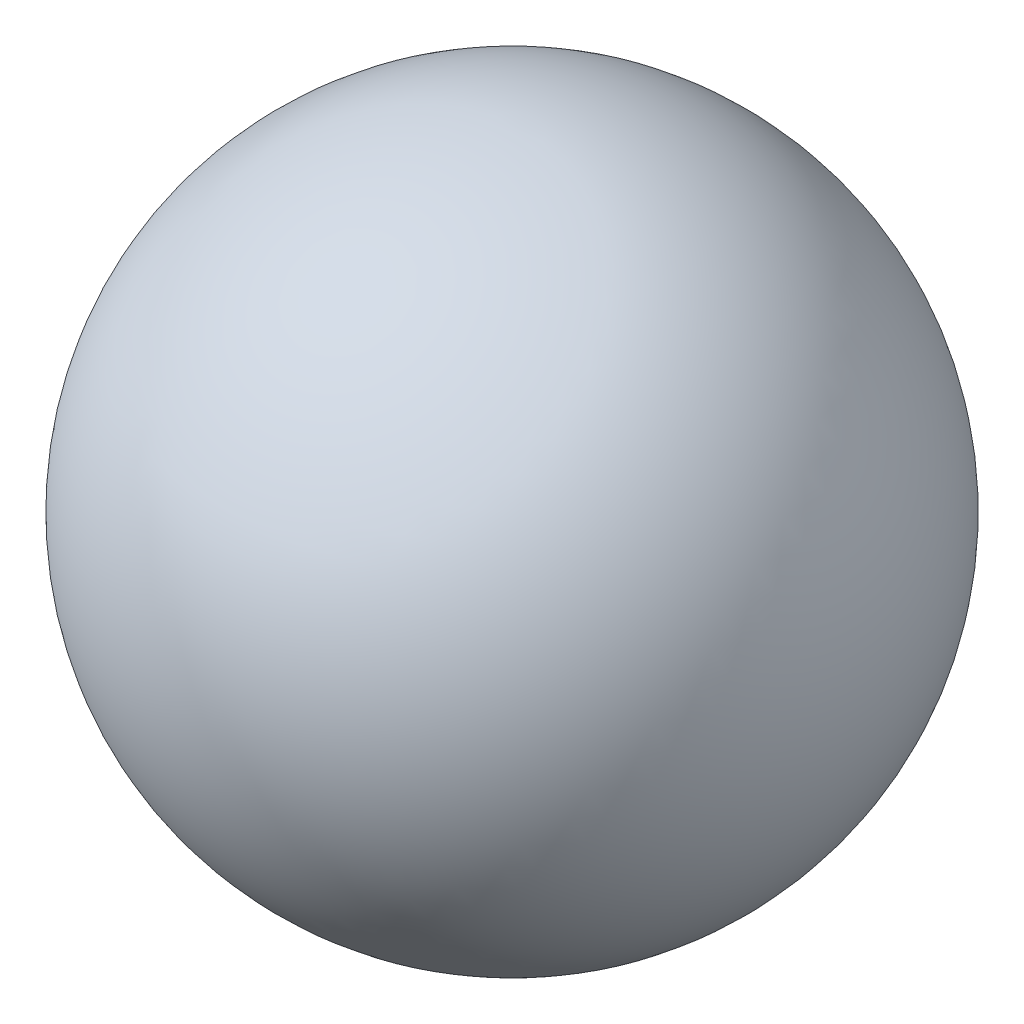
from build123d import *


with BuildPart() as part:
    # Sketch1 → Revolve1 (revolve)
    with BuildSketch(Plane.XY):
        with BuildLine():
            Line((0, 319.61), (0, 310))
            ThreePointArc((0, 310), (-310, 0), (0, -310))
            Line((0, -310), (0, -319.61))
            ThreePointArc((0, -319.61), (-319.61, 0), (0, 319.61))
        make_face()
    revolve(axis=Axis((0, 319.61, 0), (0, -1, 0)))


solid = part.part
